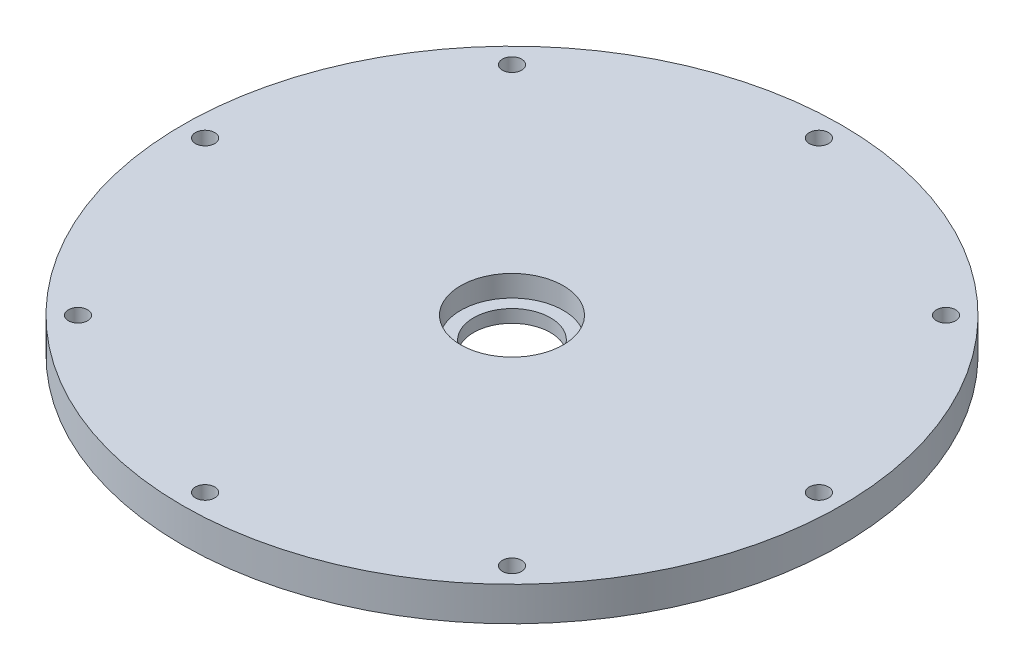
from build123d import *

# Parameters (mm, degrees)
SKETCH1_R           = 77.1
BOSS_EXTRUDE1_DEPTH = 8
SKETCH2_R           = 2.25
CUT_EXTRUDE1_DEPTH  = 110.328953164
SKETCH3_R           = 3
CUT_EXTRUDE2_DEPTH  = 5
SKETCH4_R           = 12
CUT_EXTRUDE3_DEPTH  = 5
SKETCH5_R           = 9
CUT_EXTRUDE4_DEPTH  = 5


with BuildPart() as part:
    # Sketch1 → Boss-Extrude1 (new body)
    with BuildSketch(Plane(origin=(0, 0, 0), x_dir=(1, 0, 0), z_dir=(0, 1, 0))):
        Circle(SKETCH1_R)
    extrude(amount=BOSS_EXTRUDE1_DEPTH)

    # Sketch2 → Cut-Extrude1 (cut, through all)
    with BuildSketch(Plane(origin=(0, 8, 0), x_dir=(1, 0, 0), z_dir=(0, 1, 0))):
        with Locations((0, 71.8)):
            Circle(SKETCH2_R)
        with Locations((50.770266889, 50.770266889)):
            Circle(SKETCH2_R)
        with Locations((71.8, 0)):
            Circle(SKETCH2_R)
        with Locations((50.770266889, -50.770266889)):
            Circle(SKETCH2_R)
        with Locations((0, -71.8)):
            Circle(SKETCH2_R)
        with Locations((-50.770266889, -50.770266889)):
            Circle(SKETCH2_R)
        with Locations((-71.8, 0)):
            Circle(SKETCH2_R)
        with Locations((-50.770266889, 50.770266889)):
            Circle(SKETCH2_R)
    extrude(amount=-CUT_EXTRUDE1_DEPTH, mode=Mode.SUBTRACT)

    # Sketch3 → Cut-Extrude2 (cut)
    with BuildSketch(Plane.XZ):
        with Locations((60, 0)):
            Circle(SKETCH3_R)
        with Locations((57.955549577, -15.529142706)):
            Circle(SKETCH3_R)
        with Locations((51.961524227, -30)):
            Circle(SKETCH3_R)
        with Locations((42.426406871, -42.426406871)):
            Circle(SKETCH3_R)
        with Locations((30, -51.961524227)):
            Circle(SKETCH3_R)
        with Locations((15.529142706, -57.955549577)):
            Circle(SKETCH3_R)
        with Locations((0, -60)):
            Circle(SKETCH3_R)
        with Locations((-15.529142706, -57.955549577)):
            Circle(SKETCH3_R)
        with Locations((-30, -51.961524227)):
            Circle(SKETCH3_R)
        with Locations((-42.426406871, -42.426406871)):
            Circle(SKETCH3_R)
        with Locations((-51.961524227, -30)):
            Circle(SKETCH3_R)
        with Locations((-57.955549577, -15.529142706)):
            Circle(SKETCH3_R)
        with Locations((-60, 0)):
            Circle(SKETCH3_R)
        with Locations((-57.955549577, 15.529142706)):
            Circle(SKETCH3_R)
        with Locations((-51.961524227, 30)):
            Circle(SKETCH3_R)
        with Locations((-42.426406871, 42.426406871)):
            Circle(SKETCH3_R)
        with Locations((-30, 51.961524227)):
            Circle(SKETCH3_R)
        with Locations((-15.529142706, 57.955549577)):
            Circle(SKETCH3_R)
        with Locations((0, 60)):
            Circle(SKETCH3_R)
        with Locations((15.529142706, 57.955549577)):
            Circle(SKETCH3_R)
        with Locations((30, 51.961524227)):
            Circle(SKETCH3_R)
        with Locations((42.426406871, 42.426406871)):
            Circle(SKETCH3_R)
        with Locations((51.961524227, 30)):
            Circle(SKETCH3_R)
        with Locations((57.955549577, 15.529142706)):
            Circle(SKETCH3_R)
    extrude(amount=-CUT_EXTRUDE2_DEPTH, mode=Mode.SUBTRACT)

    # Sketch4 → Cut-Extrude3 (cut)
    with BuildSketch(Plane(origin=(0, 8, 0), x_dir=(1, 0, 0), z_dir=(0, 1, 0))):
        Circle(SKETCH4_R)
    extrude(amount=-CUT_EXTRUDE3_DEPTH, mode=Mode.SUBTRACT)

    # Sketch5 → Cut-Extrude4 (cut)
    with BuildSketch(Plane(origin=(0, 3, 0), x_dir=(1, 0, 0), z_dir=(0, 1, 0))):
        Circle(SKETCH5_R)
    extrude(amount=-CUT_EXTRUDE4_DEPTH, mode=Mode.SUBTRACT)


solid = part.part
